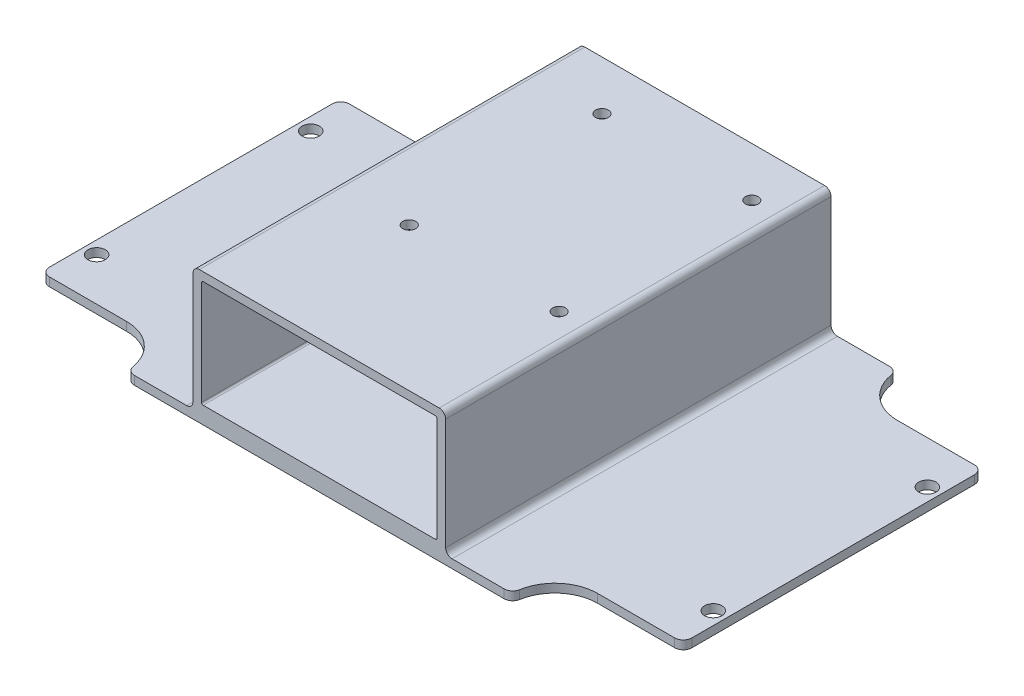
from build123d import *

# Parameters (mm, degrees)
SKETCH1_W           = 90
SKETCH1_H           = 70
SKETCH1_W_2         = 30
SKETCH1_R           = 2.025
SKETCH1_H_2         = 10
BOSS_EXTRUDE1_DEPTH = 2
SKETCH2_W           = 59
SKETCH2_H           = 90
BOSS_EXTRUDE2_DEPTH = 29
SKETCH4_W           = 55
SKETCH4_H           = 25
CUT_EXTRUDE1_DEPTH  = 87.5
FILLET1_R           = 1.5
FILLET2_R           = 0.4
FILLET3_R           = 10
FILLET7_R           = 2
SKETCH7_R           = 1.5
CUT_EXTRUDE2_DEPTH  = 5


with BuildPart() as part:
    # Sketch1 → Boss-Extrude1 (new body)
    # profile 1 of 5: a face of its own
    with BuildSketch(Plane(origin=(0, 0, 0), x_dir=(1, 0, 0), z_dir=(0, 1, 0))):
        Rectangle(SKETCH1_W, SKETCH1_H)
    # profile 2 of 5: a face of its own
    with BuildSketch(Plane(origin=(0, 0, 0), x_dir=(1, 0, 0), z_dir=(0, 1, 0))):
        with Locations((-60, 0)):
            Rectangle(SKETCH1_W_2, SKETCH1_H)
        with Locations(Location((-72, -25, 0), (0, 0, 270))):
            Circle(SKETCH1_R, mode=Mode.SUBTRACT)
        with Locations(Location((-72, 25, 0), (0, 0, 270))):
            Circle(SKETCH1_R, mode=Mode.SUBTRACT)
    # profile 3 of 5: a face of its own
    with BuildSketch(Plane(origin=(0, 0, 0), x_dir=(1, 0, 0), z_dir=(0, 1, 0))):
        with Locations((60, 0)):
            Rectangle(SKETCH1_W_2, SKETCH1_H)
        with Locations(Location((72, -25, 0), (0, 0, 270))):
            Circle(SKETCH1_R, mode=Mode.SUBTRACT)
        with Locations(Location((72, 25, 0), (0, 0, 270))):
            Circle(SKETCH1_R, mode=Mode.SUBTRACT)
    # profile 4 of 5: a face of its own
    with BuildSketch(Plane(origin=(0, 0, 0), x_dir=(1, 0, 0), z_dir=(0, 1, 0))):
        with Locations((0, -40)):
            Rectangle(SKETCH1_W, SKETCH1_H_2)
    # profile 5 of 5: a face of its own
    with BuildSketch(Plane(origin=(0, 0, 0), x_dir=(1, 0, 0), z_dir=(0, 1, 0))):
        with Locations((0, 40)):
            Rectangle(SKETCH1_W, SKETCH1_H_2)
    extrude(amount=BOSS_EXTRUDE1_DEPTH)

    # Sketch2 → Boss-Extrude2 (add)
    with BuildSketch(Plane(origin=(0, 2, 0), x_dir=(1, 0, 0), z_dir=(0, 1, 0))):
        Rectangle(SKETCH2_W, SKETCH2_H)
    extrude(amount=BOSS_EXTRUDE2_DEPTH)

    # Sketch4 → Cut-Extrude1 (cut)
    with BuildSketch(Plane.XY.offset(45)):
        with Locations((0, 16.5)):
            Rectangle(SKETCH4_W, SKETCH4_H)
    extrude(amount=-CUT_EXTRUDE1_DEPTH, mode=Mode.SUBTRACT)

    # Fillet1
    fillet1_edges = [part.edges().sort_by_distance(p)[0] for p in [
        (-29.5, 2, 0),
        (29.5, 2, 0),
        (-29.5, 31, 0),
        (29.5, 31, 0),
    ]]
    fillet(fillet1_edges, radius=FILLET1_R)

    # Fillet2
    fillet2_edges = [part.edges().sort_by_distance(p)[0] for p in [
        (-27.5, 4, 1.25),
        (0, 29, -42.5),
        (-27.5, 29, 1.25),
        (27.5, 16.5, -42.5),
        (27.5, 29, 1.25),
        (27.5, 4, 1.25),
        (-27.5, 16.5, -42.5),
        (0, 4, -42.5),
    ]]
    fillet(fillet2_edges, radius=FILLET2_R)

    # Fillet3
    fillet3_edges = [part.edges().sort_by_distance(p)[0] for p in [
        (-45, 1, 35),
        (-45, 1, -35),
        (45, 1, -35),
        (45, 1, 35),
    ]]
    fillet(fillet3_edges, radius=FILLET3_R - 0.0001)  # a hair under: the kernel refuses the full size

    # Fillet7
    fillet7_edges = [part.edges().sort_by_distance(p)[0] for p in [
        (-45, 1, -45),
        (45, 1, -45),
        (75, 1, -35),
        (75, 1, 35),
        (45, 1, 45),
        (-45, 1, 45),
        (-75, 1, 35),
        (-75, 1, -35),
    ]]
    fillet(fillet7_edges, radius=FILLET7_R)

    # Sketch7 → Cut-Extrude2 (cut)
    with BuildSketch(Plane(origin=(0, 31, 0), x_dir=(1, 0, 0), z_dir=(0, 1, 0))):
        with Locations(Location((-12.5, 33.5, 0), (0, 0, 270))):
            Circle(SKETCH7_R)
        with Locations(Location((22.5, 33.5, 0), (0, 0, 270))):
            Circle(SKETCH7_R)
        with Locations(Location((22.5, -11.5, 0), (0, 0, 270))):
            Circle(SKETCH7_R)
        with Locations(Location((-12.5, -11.5, 0), (0, 0, 270))):
            Circle(SKETCH7_R)
    extrude(amount=-CUT_EXTRUDE2_DEPTH, mode=Mode.SUBTRACT)


solid = part.part
